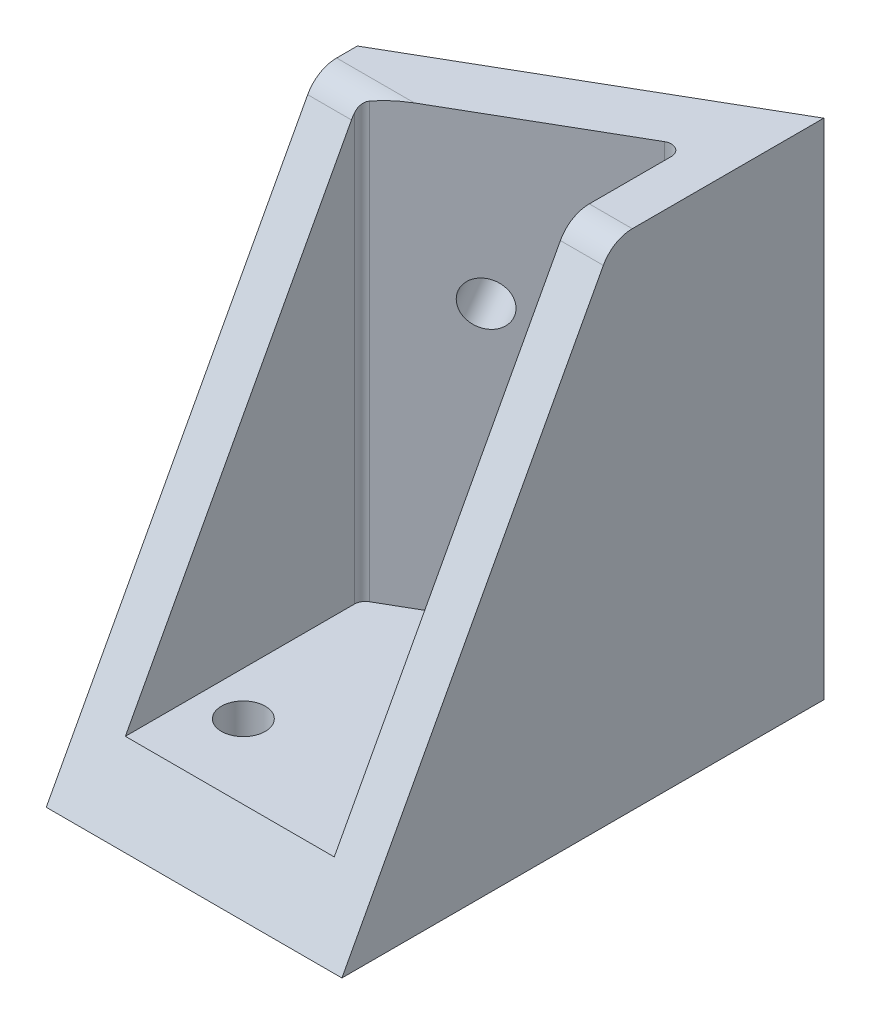
from build123d import *

# Parameters (mm, degrees)
SKETCH1_W           = 27
SKETCH1_H           = 44
BOSS_EXTRUDE1_DEPTH = 6
CUT_EXTRUDE1_DEPTH  = 27.5
BOSS_EXTRUDE2_DEPTH = 40
BOSS_EXTRUDE3_DEPTH = 40
BOSS_EXTRUDE5_DEPTH = 40
SKETCH6_R           = 2
CUT_EXTRUDE2_DEPTH  = 10
CUT_EXTRUDE3_DEPTH  = 58.697486947
FILLET1_R           = 1
SKETCH5_R           = 2
CUT_EXTRUDE4_DEPTH  = 48.605146781
FILLET2_R           = 3


with BuildPart() as part:
    # Sketch1 → Boss-Extrude1 (new body)
    with BuildSketch(Plane(origin=(0, 0, 0), x_dir=(1, 0, 0), z_dir=(0, 1, 0))):
        Rectangle(SKETCH1_W, SKETCH1_H)
    extrude(amount=BOSS_EXTRUDE1_DEPTH)

    # Sketch2 → Cut-Extrude1 (cut, through all)
    with BuildSketch(Plane(origin=(0, 6, 0), x_dir=(1, 0, 0), z_dir=(0, 1, 0))):
        Polygon((13.5, 22), (-13.5, 6.411542732), (-13.5, 22), align=None)
    extrude(amount=-CUT_EXTRUDE1_DEPTH, mode=Mode.SUBTRACT)

    # Sketch4 → Boss-Extrude2 (add)
    with BuildSketch(Plane(origin=(0, 6, 0), x_dir=(1, 0, 0), z_dir=(0, 1, 0))):
        Polygon((-13.5, 6.411542732), (-13.5, 0.411542732), (13.5, 16), (13.5, 22), align=None)
    extrude(amount=BOSS_EXTRUDE2_DEPTH)

    # Sketch18 → Boss-Extrude3 (add)
    with BuildSketch(Plane(origin=(0, 6, 0), x_dir=(1, 0, 0), z_dir=(0, 1, 0))):
        Polygon((-13.5, -22), (-9.5, -22), (-9.5, 2.720943809), (-13.5, 0.411542732), align=None)
    extrude(amount=BOSS_EXTRUDE3_DEPTH)

    # Sketch19 → Boss-Extrude5 (add)
    with BuildSketch(Plane(origin=(0, 6, 0), x_dir=(1, 0, 0), z_dir=(0, 1, 0))):
        Polygon((13.5, 16), (9.575964778, 13.734457208), (9.575964778, -22), (13.5, -22), align=None)
    extrude(amount=BOSS_EXTRUDE5_DEPTH)

    # Sketch6 → Cut-Extrude2 (cut)
    with BuildSketch(Plane(origin=(-6.151279442, 0, -10.654328524), x_dir=(-0.8660254037844417, 0, 0.4999999999999949), z_dir=(-0.4999999999999949, 0, -0.8660254037844417))):
        with Locations((-6.514428415, 18.5)):
            Circle(SKETCH6_R)
        with Locations((-1.514428415, 31)):
            Circle(SKETCH6_R)
    extrude(amount=-CUT_EXTRUDE2_DEPTH, mode=Mode.SUBTRACT)

    # Sketch20 → Cut-Extrude3 (cut, through all)
    with BuildSketch(Plane.ZY.offset(13.5)):
        Polygon((22, 0), (-2.721542732, 46), (22, 46), align=None)
    extrude(amount=-CUT_EXTRUDE3_DEPTH, mode=Mode.SUBTRACT)

    # Fillet1
    # the kernel refuses this fillet: 1 mm, written as the material it adds along each edge
    with BuildSketch(Plane(origin=(-9.5, 4.556624327, -2.720943809), x_dir=(0.8660254037844415, 0, -0.4999999999999951), z_dir=(0, 1, 0))) as fillet1_piece_1_section:
        with BuildLine():
            CenterArc((FILLET1_R * 0.57735026919, -FILLET1_R), FILLET1_R, 90, 60)
            Line((-FILLET1_R * 0.288675134595, -FILLET1_R * 0.5), (0, 0))
            Line((0, 0), (FILLET1_R * 0.57735026919, 0))
        make_face()
    fillet1_piece_1 = extrude(amount=42.885636914, mode=Mode.PRIVATE)
    fillet1_piece_1 = split(fillet1_piece_1, bisect_by=Plane(origin=(-9.391668289, 14.377701734, 14.273065917), z_dir=(0, -0.47339174882638807, -0.8808520035415109)), keep=Keep.TOP, mode=Mode.PRIVATE)
    fillet1_piece_1 = split(fillet1_piece_1, bisect_by=Plane(origin=(-9.391668289, 46, -2.658398466), z_dir=(0, -1, 0)), keep=Keep.TOP, mode=Mode.PRIVATE)
    add(fillet1_piece_1)
    with BuildSketch(Plane(origin=(9.575964778, 1.669872981, -13.734457208), x_dir=(-0.8660254037844415, 0, 0.4999999999999951), z_dir=(0, 1, 0))) as fillet1_piece_2:
        with BuildLine():
            CenterArc((FILLET1_R * 1.73205080757, FILLET1_R), FILLET1_R, 150, 120)
            Line((FILLET1_R * 0.866025403784, FILLET1_R * 1.5), (0, 0))
            Line((0, 0), (FILLET1_R * 1.73205080757, 0))
        make_face()
    extrude(amount=44.330127019)

    # Sketch5 → Cut-Extrude4 (cut, through all)
    with BuildSketch(Plane(origin=(0, 6, 0), x_dir=(1, 0, 0), z_dir=(0, 1, 0))):
        with Locations(Location((-5.5, -12, 0), (0, 0, 270))):
            Circle(SKETCH5_R)
        with Locations(Location((4.5, -2, 0), (0, 0, 270))):
            Circle(SKETCH5_R)
    extrude(amount=-CUT_EXTRUDE4_DEPTH, mode=Mode.SUBTRACT)

    # Fillet2
    # the kernel refuses this fillet: 3 mm, written as the material it takes off along each edge
    with BuildSketch(Plane(origin=(5.092167423, 46, -2.721542732), x_dir=(0, 0, -1), z_dir=(1, 0, 0))) as fillet2_piece_1:
        with BuildLine():
            CenterArc((FILLET2_R * 0.59783964736, -FILLET2_R), FILLET2_R, 90, 61.74531149)
            Line((-FILLET2_R * 0.283012356181, -FILLET2_R * 0.526608251174), (0, 0))
            Line((0, 0), (FILLET2_R * 0.59783964736, 0))
        make_face()
    extrude(amount=12.891629932, mode=Mode.SUBTRACT)
    with BuildSketch(Plane(origin=(-17.983797355, 46, -2.721542732), x_dir=(0, 0, -1), z_dir=(1, 0, 0))) as fillet2_piece_2:
        with BuildLine():
            CenterArc((FILLET2_R * 0.59783964736, -FILLET2_R), FILLET2_R, 90, 61.74531149)
            Line((-FILLET2_R * 0.283012356181, -FILLET2_R * 0.526608251174), (0, 0))
            Line((0, 0), (FILLET2_R * 0.59783964736, 0))
        make_face()
    extrude(amount=8.484834721, mode=Mode.SUBTRACT)
    with BuildSketch(Plane(origin=(-4.832275393, 46, -2.721542732), x_dir=(0, 0, -1), z_dir=(-1, 0, 0))) as fillet2_piece_3:
        with BuildLine():
            CenterArc((FILLET2_R * 0.59783964736, FILLET2_R), FILLET2_R, 208.25468851, 61.74531149)
            Line((-FILLET2_R * 0.283012356181, FILLET2_R * 0.526608251174), (0, 0))
            Line((0, 0), (FILLET2_R * 0.59783964736, 0))
        make_face()
    extrude(amount=4.666687241, mode=Mode.SUBTRACT)


solid = part.part
